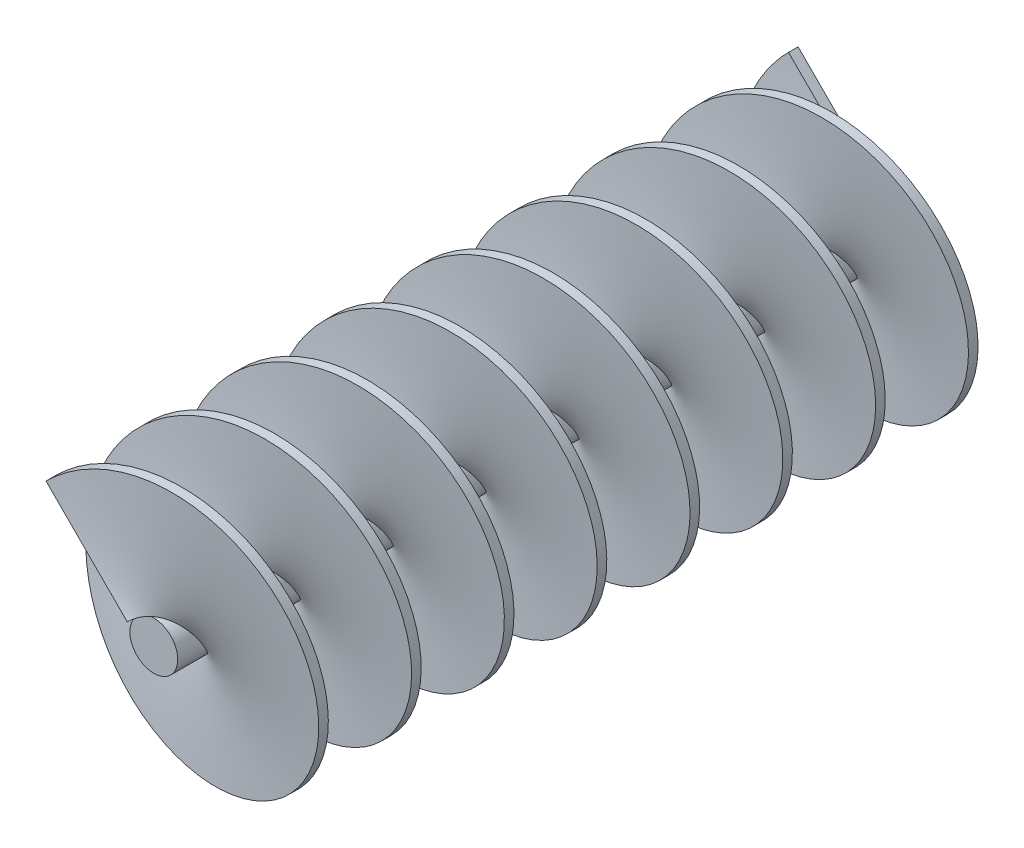
from build123d import *
from build123d.topology import SkipClean

# Parameters (mm, degrees)
SKETCH_1_R          = 5
EXTRUDE_1_DEPTH     = 155
SWEEP_1_PITCH       = 19.375
SKETCH_5_R          = 4
CUT_EXTRUDE_1_DEPTH = 8


with BuildPart() as part:
    # 草图1 → 凸台-拉伸1 (new body)
    with BuildSketch(Plane.XY):
        Circle(SKETCH_1_R)
    extrude(amount=EXTRUDE_1_DEPTH)

    # 扫描1: arcs per turn and ends read off the stored shape
    # 扫描1: the profile of 草图4 profile screwed along a right-hand helix through 8 turns, 20 arcs to a turn; built about Z, then put on its axis
    with SkipClean():  # the faces are left unmerged after this step: merging them gives an invalid solid
        sweep_1_z = Axis((0, 0, 0), (0, 0, 1))
        sweep_1_corners = [(4.9997, 0, 0), (29, 0, 0), (29, 0, -2), (4.9997, 0, -2)]
        with BuildLine(mode=Mode.PRIVATE) as sweep_1_profile:
            Line(sweep_1_corners[0], sweep_1_corners[1])
            Line(sweep_1_corners[1], sweep_1_corners[2])
            Line(sweep_1_corners[2], sweep_1_corners[3])
            Line(sweep_1_corners[3], sweep_1_corners[0])
        sweep_1_cap = Face(sweep_1_profile.wire())
        sweep_1_turn_angles = [0, 9, 18, 27, 36, 45, 54, 63, 72, 81, 90, 99, 108, 117, 126, 135, 144, 153, 162, 171, 180, 189, 198, 207, 216, 225, 234, 243, 252, 261, 270, 279, 288, 297, 306, 315, 324, 333, 342, 351, 360]
        sweep_1_turn_weights = [1, 0.9876883405951378, 1, 0.9876883405951378, 1, 0.9876883405951378, 1, 0.9876883405951378, 1, 0.9876883405951378, 1, 0.9876883405951378, 1, 0.9876883405951378, 1, 0.9876883405951378, 1, 0.9876883405951378, 1, 0.9876883405951378, 1, 0.9876883405951378, 1, 0.9876883405951378, 1, 0.9876883405951378, 1, 0.9876883405951378, 1, 0.9876883405951378, 1, 0.9876883405951378, 1, 0.9876883405951378, 1, 0.9876883405951378, 1, 0.9876883405951378, 1, 0.9876883405951378, 1]
        sweep_1_turn_rails = [Edge.make_bspline([Vector(p[0], p[1], 0).rotate(sweep_1_z, sweep_1_turn_angles[k]) / sweep_1_turn_weights[k] + Vector(0, 0, p[2] + SWEEP_1_PITCH * sweep_1_turn_angles[k] / 360) for k in range(41)], [0, 0, 0, 1, 1, 2, 2, 3, 3, 4, 4, 5, 5, 6, 6, 7, 7, 8, 8, 9, 9, 10, 10, 11, 11, 12, 12, 13, 13, 14, 14, 15, 15, 16, 16, 17, 17, 18, 18, 19, 19, 20, 20, 20], 2, sweep_1_turn_weights) for p in sweep_1_corners]
        sweep_1_turn_sides = [Face.make_surface_from_curves(sweep_1_turn_rails[p[0]], sweep_1_turn_rails[p[1]]) for p in [(0, 1), (1, 2), (2, 3), (3, 0)]]
        sweep_1 = Plane(origin=(0, 0, 155), x_dir=(-0.7071067811865512, 0.7071067811865438, 0), z_dir=(0, 0, -1)) * Solid(Shell([*[p.moved(Location((0, 0, SWEEP_1_PITCH * i))) for i in range(8) for p in sweep_1_turn_sides], sweep_1_cap, sweep_1_cap.rotate(sweep_1_z, 2880).moved(Location((0, 0, SWEEP_1_PITCH * 2880 / 360)))]))
        add(sweep_1)

    # 草图5 → 切除-拉伸1 (cut)
    with SkipClean():  # the faces are left unmerged after this step: merging them gives an invalid solid
        with BuildSketch(Plane(origin=(0, 0, 0), x_dir=(-1, 0, 0), z_dir=(0, 0, -1))):
            Circle(SKETCH_5_R)
        extrude(amount=-CUT_EXTRUDE_1_DEPTH, mode=Mode.SUBTRACT)


solid = part.part
